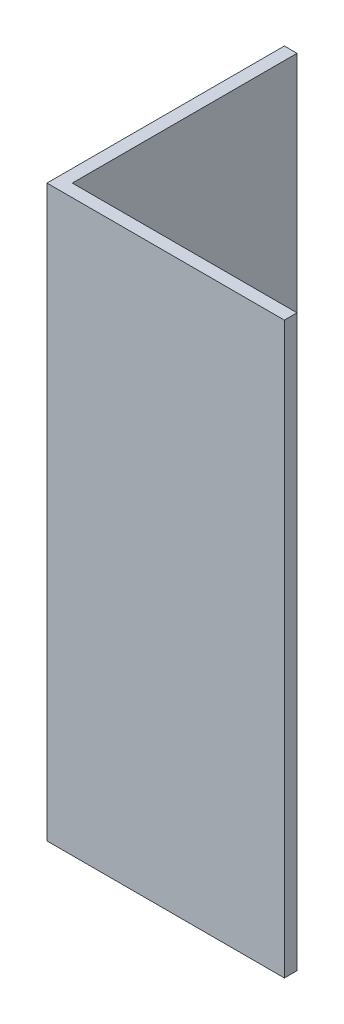
from build123d import *

# Parameters (mm, degrees)
EXTRUDE_1_DEPTH     = 180
SKETCH_6_R          = 5
CUT_EXTRUDE_1_DEPTH = 10


with BuildPart() as part:
    # Эскиз1 → Вытянуть-Тонкостенный1 (new body)
    with BuildSketch(Plane(origin=(0, 0, 0), x_dir=(1, 0, 0), z_dir=(0, 1, 0))):
        Polygon((0, 75), (0, 0), (75, 0), (75, 4), (4, 4), (4, 75), align=None)
    extrude(amount=EXTRUDE_1_DEPTH)

    # Эскиз6 → Вырез-Вытянуть1 (cut)
    with BuildSketch(Plane.ZY):
        with Locations((-37.5, 25)):
            Circle(SKETCH_6_R)
        with Locations((-37.5, 75)):
            Circle(SKETCH_6_R)
        with Locations((-37.5, 125)):
            Circle(SKETCH_6_R)
    extrude(amount=-CUT_EXTRUDE_1_DEPTH, mode=Mode.SUBTRACT)


solid = part.part
